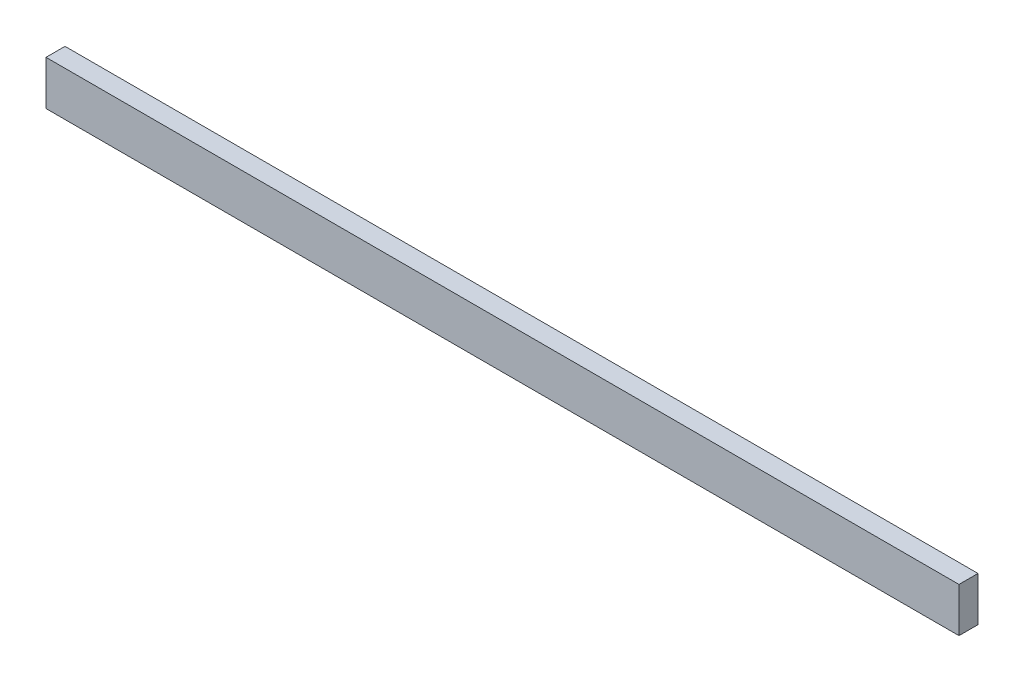
from build123d import *

# Parameters (mm, degrees)
SKETCH1_W           = 1828.8
SKETCH1_H           = 88.9
BOSS_EXTRUDE1_DEPTH = 38.1


with BuildPart() as part:
    # Sketch1 → Boss-Extrude1 (new body)
    with BuildSketch(Plane.XY):
        with Locations((914.4, 44.45)):
            Rectangle(SKETCH1_W, SKETCH1_H)
    extrude(amount=BOSS_EXTRUDE1_DEPTH)


solid = part.part
